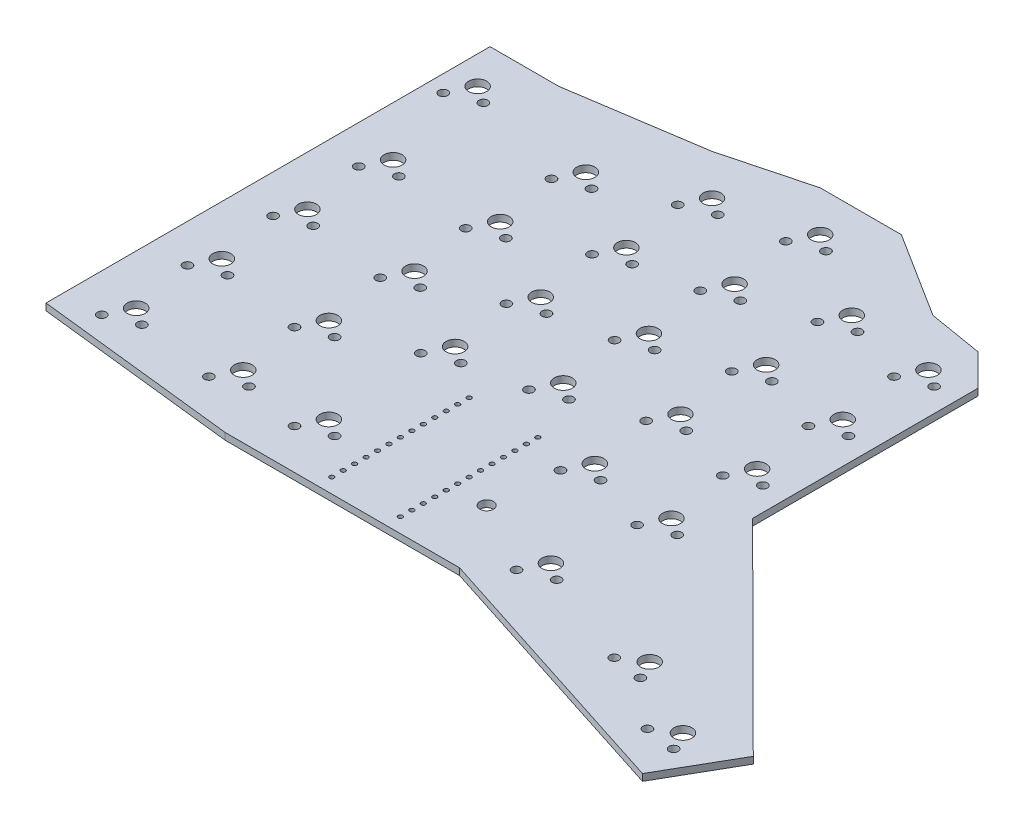
from build123d import *

# Parameters (mm, degrees)
BOSS_EXTRUDE1_DEPTH = 1.5
SKETCH2_R           = 0.5
SKETCH2_R_2         = 1.5
CUT_EXTRUDE1_DEPTH  = 173.016549958
SKETCH3_R           = 2
CUT_EXTRUDE2_DEPTH  = 173.016549958
SKETCH4_R           = 1
CUT_EXTRUDE3_DEPTH  = 173.016549958


with BuildPart() as part:
    # Sketch1 → Boss-Extrude1 (new body)
    with BuildSketch(Plane(origin=(0, 0, 0), x_dir=(1, 0, 0), z_dir=(0, 1, 0))):
        Polygon((87, 18), (94, 11), (94, -39), (139.782620217, -84.636279582), (130.810886505, -100.241022266), (71, -81), (19, -81), (-25.75, -76), (-25.75, 22.5), (-10.5, 22.5), (19, 27), (38, 32), (56, 32), (75, 20), align=None)
    extrude(amount=-BOSS_EXTRUDE1_DEPTH)

    # Sketch2 → Cut-Extrude1 (cut, through all)
    with BuildSketch(Plane(origin=(0, 0, 0), x_dir=(1, 0, 0), z_dir=(0, 1, 0))):
        with Locations((39.38, -77.75)):
            Circle(SKETCH2_R)
        with Locations((39.38, -75.21)):
            Circle(SKETCH2_R)
        with Locations((39.38, -72.67)):
            Circle(SKETCH2_R)
        with Locations((39.38, -70.13)):
            Circle(SKETCH2_R)
        with Locations((39.38, -67.59)):
            Circle(SKETCH2_R)
        with Locations((39.38, -65.05)):
            Circle(SKETCH2_R)
        with Locations((39.38, -62.51)):
            Circle(SKETCH2_R)
        with Locations((39.38, -59.97)):
            Circle(SKETCH2_R)
        with Locations((39.38, -57.43)):
            Circle(SKETCH2_R)
        with Locations((39.38, -54.89)):
            Circle(SKETCH2_R)
        with Locations((39.38, -52.35)):
            Circle(SKETCH2_R)
        with Locations((39.38, -49.81)):
            Circle(SKETCH2_R)
        with Locations((39.38, -47.27)):
            Circle(SKETCH2_R)
        with Locations((54.62, -47.27)):
            Circle(SKETCH2_R)
        with Locations((54.62, -49.81)):
            Circle(SKETCH2_R)
        with Locations((54.62, -52.35)):
            Circle(SKETCH2_R)
        with Locations((54.62, -54.89)):
            Circle(SKETCH2_R)
        with Locations((54.62, -57.43)):
            Circle(SKETCH2_R)
        with Locations((54.62, -59.97)):
            Circle(SKETCH2_R)
        with Locations((54.62, -62.51)):
            Circle(SKETCH2_R)
        with Locations((54.62, -65.05)):
            Circle(SKETCH2_R)
        with Locations((54.62, -67.59)):
            Circle(SKETCH2_R)
        with Locations((54.62, -70.13)):
            Circle(SKETCH2_R)
        with Locations((54.62, -72.67)):
            Circle(SKETCH2_R)
        with Locations((54.62, -75.21)):
            Circle(SKETCH2_R)
        with Locations((54.62, -77.75)):
            Circle(SKETCH2_R)
        with Locations((62, -66)):
            Circle(SKETCH2_R_2)
    extrude(amount=-CUT_EXTRUDE1_DEPTH, mode=Mode.SUBTRACT)

    # Sketch3 → Cut-Extrude2 (cut, through all)
    with BuildSketch(Plane(origin=(0, 0, 0), x_dir=(1, 0, 0), z_dir=(0, 1, 0))):
        with Locations((-19.5, 13.5)):
            Circle(SKETCH3_R)
        with Locations((9, 9)):
            Circle(SKETCH3_R)
        with Locations((28, 18)):
            Circle(SKETCH3_R)
        with Locations((47, 23)):
            Circle(SKETCH3_R)
        with Locations((66, 11)):
            Circle(SKETCH3_R)
        with Locations((85, 9)):
            Circle(SKETCH3_R)
        with Locations((-14.75, -10)):
            Circle(SKETCH3_R)
        with Locations((9, -10)):
            Circle(SKETCH3_R)
        with Locations((28, -1)):
            Circle(SKETCH3_R)
        with Locations((47, 4)):
            Circle(SKETCH3_R)
        with Locations((66, -8)):
            Circle(SKETCH3_R)
        with Locations((85, -10)):
            Circle(SKETCH3_R)
        with Locations((47, -15)):
            Circle(SKETCH3_R)
        with Locations((-14.75, -29)):
            Circle(SKETCH3_R)
        with Locations((-14.75, -48)):
            Circle(SKETCH3_R)
        with Locations((-14.75, -67)):
            Circle(SKETCH3_R)
        with Locations((9, -29)):
            Circle(SKETCH3_R)
        with Locations((9, -48)):
            Circle(SKETCH3_R)
        with Locations((9, -67)):
            Circle(SKETCH3_R)
        with Locations((28, -67)):
            Circle(SKETCH3_R)
        with Locations((28, -39)):
            Circle(SKETCH3_R)
        with Locations((28, -20)):
            Circle(SKETCH3_R)
        with Locations((47, -34)):
            Circle(SKETCH3_R)
        with Locations((66, -27)):
            Circle(SKETCH3_R)
        with Locations((85, -29)):
            Circle(SKETCH3_R)
        with Locations((85, -48)):
            Circle(SKETCH3_R)
        with Locations((66, -46)):
            Circle(SKETCH3_R)
        with Locations((80.25, -70)):
            Circle(SKETCH3_R)
        with Locations((110.155779038, -77.984191056)):
            Circle(SKETCH3_R)
        with Locations((127.494382019, -87.952784068)):
            Circle(SKETCH3_R)
    extrude(amount=-CUT_EXTRUDE2_DEPTH, mode=Mode.SUBTRACT)

    # Sketch4 → Cut-Extrude3 (cut, through all)
    with BuildSketch(Plane(origin=(0, 0, 0), x_dir=(1, 0, 0), z_dir=(0, 1, 0))):
        with Locations((-22.04, 8.42)):
            Circle(SKETCH4_R)
        with Locations((-15.69, 10.96)):
            Circle(SKETCH4_R)
        with Locations((-10.94, -12.54)):
            Circle(SKETCH4_R)
        with Locations((-17.29, -15.08)):
            Circle(SKETCH4_R)
        with Locations((-10.94, -31.54)):
            Circle(SKETCH4_R)
        with Locations((-17.29, -34.08)):
            Circle(SKETCH4_R)
        with Locations((-10.94, -50.54)):
            Circle(SKETCH4_R)
        with Locations((-17.29, -53.08)):
            Circle(SKETCH4_R)
        with Locations((-17.29, -72.08)):
            Circle(SKETCH4_R)
        with Locations((-10.94, -69.54)):
            Circle(SKETCH4_R)
        with Locations((6.46, -72.08)):
            Circle(SKETCH4_R)
        with Locations((12.81, -69.54)):
            Circle(SKETCH4_R)
        with Locations((25.46, -72.08)):
            Circle(SKETCH4_R)
        with Locations((31.81, -69.54)):
            Circle(SKETCH4_R)
        with Locations((6.46, -53.08)):
            Circle(SKETCH4_R)
        with Locations((12.81, -50.54)):
            Circle(SKETCH4_R)
        with Locations((6.46, -34.08)):
            Circle(SKETCH4_R)
        with Locations((12.81, -31.54)):
            Circle(SKETCH4_R)
        with Locations((25.46, -44.08)):
            Circle(SKETCH4_R)
        with Locations((31.81, -41.54)):
            Circle(SKETCH4_R)
        with Locations((25.46, -25.08)):
            Circle(SKETCH4_R)
        with Locations((31.81, -22.54)):
            Circle(SKETCH4_R)
        with Locations((6.46, -15.08)):
            Circle(SKETCH4_R)
        with Locations((12.81, -12.54)):
            Circle(SKETCH4_R)
        with Locations((6.46, 3.92)):
            Circle(SKETCH4_R)
        with Locations((12.81, 6.46)):
            Circle(SKETCH4_R)
        with Locations((25.46, 12.92)):
            Circle(SKETCH4_R)
        with Locations((31.81, 15.46)):
            Circle(SKETCH4_R)
        with Locations((25.46, -6.08)):
            Circle(SKETCH4_R)
        with Locations((31.81, -3.54)):
            Circle(SKETCH4_R)
        with Locations((44.46, 17.92)):
            Circle(SKETCH4_R)
        with Locations((50.81, 20.46)):
            Circle(SKETCH4_R)
        with Locations((44.46, -1.08)):
            Circle(SKETCH4_R)
        with Locations((50.81, 1.46)):
            Circle(SKETCH4_R)
        with Locations((44.46, -20.08)):
            Circle(SKETCH4_R)
        with Locations((50.81, -17.54)):
            Circle(SKETCH4_R)
        with Locations((44.46, -39.08)):
            Circle(SKETCH4_R)
        with Locations((50.81, -36.54)):
            Circle(SKETCH4_R)
        with Locations((69.81, 8.46)):
            Circle(SKETCH4_R)
        with Locations((63.46, 5.92)):
            Circle(SKETCH4_R)
        with Locations((82.46, 3.92)):
            Circle(SKETCH4_R)
        with Locations((88.81, 6.46)):
            Circle(SKETCH4_R)
        with Locations((69.81, -10.54)):
            Circle(SKETCH4_R)
        with Locations((63.46, -13.08)):
            Circle(SKETCH4_R)
        with Locations((82.46, -15.08)):
            Circle(SKETCH4_R)
        with Locations((88.81, -12.54)):
            Circle(SKETCH4_R)
        with Locations((63.46, -32.08)):
            Circle(SKETCH4_R)
        with Locations((69.81, -29.54)):
            Circle(SKETCH4_R)
        with Locations((63.46, -51.08)):
            Circle(SKETCH4_R)
        with Locations((69.81, -48.54)):
            Circle(SKETCH4_R)
        with Locations((82.46, -34.08)):
            Circle(SKETCH4_R)
        with Locations((88.81, -31.54)):
            Circle(SKETCH4_R)
        with Locations((88.81, -50.54)):
            Circle(SKETCH4_R)
        with Locations((82.46, -53.08)):
            Circle(SKETCH4_R)
        with Locations((77.71, -75.08)):
            Circle(SKETCH4_R)
        with Locations((84.06, -72.54)):
            Circle(SKETCH4_R)
        with Locations((105.42167664, -81.122068441)):
            Circle(SKETCH4_R)
        with Locations((112.192670707, -82.085260712)):
            Circle(SKETCH4_R)
        with Locations((122.760279622, -91.090661454)):
            Circle(SKETCH4_R)
        with Locations((129.531273688, -92.053853725)):
            Circle(SKETCH4_R)
    extrude(amount=-CUT_EXTRUDE3_DEPTH, mode=Mode.SUBTRACT)


solid = part.part
